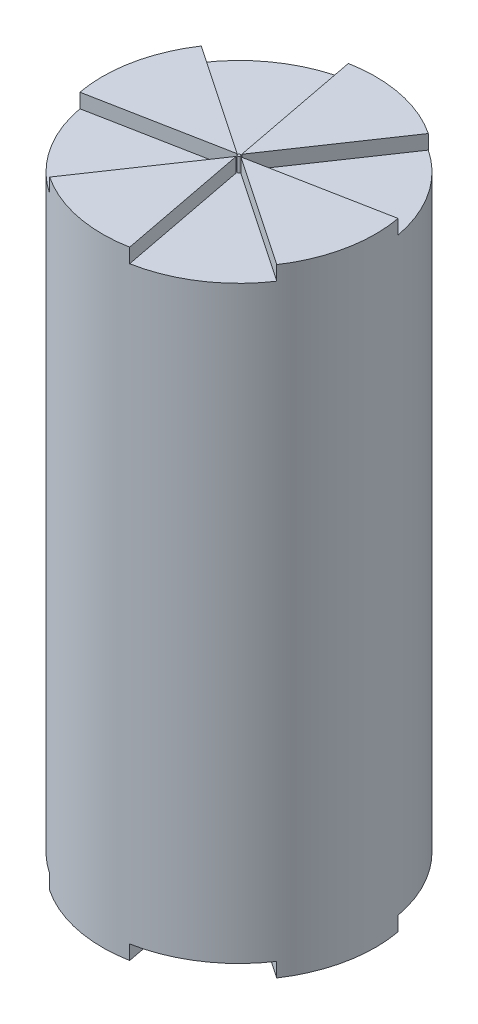
from build123d import *

# Parameters (mm, degrees)
SKETCH1_R            = 24.13
BOSS_EXTRUDE1_DEPTH  = 109.22
CUT_EXTRUDE7_START   = -2.54
CUT_EXTRUDE7_DEPTH   = 2.54
CIRPATTERN2_COUNT    = 4
MIRROR1_START        = -2.54
MIRROR1_COPY_1_DEPTH = 2.54
MIRROR1_COPY_2_DEPTH = 2.54
MIRROR1_COPY_3_DEPTH = 2.54
MIRROR1_COPY_4_DEPTH = 2.54


with BuildPart() as part:
    # Sketch1 → Boss-Extrude1 (new body)
    with BuildSketch(Plane(origin=(0, 0, 0), x_dir=(1, 0, 0), z_dir=(0, 1, 0))):
        Circle(SKETCH1_R)
    extrude(amount=BOSS_EXTRUDE1_DEPTH)

    # Sketch2 → Cut-Extrude7 (cut)
    with BuildSketch(Plane(origin=(0, 109.22, 0), x_dir=(1, 0, 0), z_dir=(0, 1, 0)).offset(CUT_EXTRUDE7_START)):
        with BuildLine():
            Line((-13.398366618, -20.068399836), (0.023672, -0.252894516))
            ThreePointArc((0.023672, -0.252894516), (-0.212080054, -0.139778577), (-0.223069042, 0.12147511))
            Line((-0.223069042, 0.12147511), (-23.725561751, -4.399388549))
            ThreePointArc((-23.725561751, -4.399388549), (-20.147605145, -13.278964829), (-13.398366618, -20.068399836))
        make_face()
    cut_extrude7 = extrude(amount=CUT_EXTRUDE7_DEPTH, mode=Mode.SUBTRACT)

    # CirPattern2: Cut-Extrude7 ×4 about axis
    cirpattern2_axis = Axis((0, 109.22, 0), (0, 1, 0))
    for i in range(1, CIRPATTERN2_COUNT):
        add(cut_extrude7.rotate(cirpattern2_axis, i * 360 / CIRPATTERN2_COUNT), mode=Mode.SUBTRACT)

    # Mirror1 copy 1 sketch → Mirror1 copy 1 (cut)
    with BuildSketch(Plane(origin=(0, 0, 0), x_dir=(0, 0, -1), z_dir=(0, -1, 0)).offset(MIRROR1_START)):
        with BuildLine():
            Line((-13.398366618, 20.068399836), (0.023672, 0.252894516))
            ThreePointArc((0.023672, 0.252894516), (-0.212080054, 0.139778577), (-0.223069042, -0.12147511))
            Line((-0.223069042, -0.12147511), (-23.725561751, 4.399388549))
            ThreePointArc((-23.725561751, 4.399388549), (-20.147605145, 13.278964829), (-13.398366618, 20.068399836))
        make_face()
    extrude(amount=MIRROR1_COPY_1_DEPTH, mode=Mode.SUBTRACT)

    # Mirror1 copy 2 sketch → Mirror1 copy 2 (cut)
    with BuildSketch(Plane(origin=(0, 0, 0), x_dir=(-1, 0, 0), z_dir=(0, -1, 0)).offset(MIRROR1_START)):
        with BuildLine():
            Line((-13.398366618, 20.068399836), (0.023672, 0.252894516))
            ThreePointArc((0.023672, 0.252894516), (-0.212080054, 0.139778577), (-0.223069042, -0.12147511))
            Line((-0.223069042, -0.12147511), (-23.725561751, 4.399388549))
            ThreePointArc((-23.725561751, 4.399388549), (-20.147605145, 13.278964829), (-13.398366618, 20.068399836))
        make_face()
    extrude(amount=MIRROR1_COPY_2_DEPTH, mode=Mode.SUBTRACT)

    # Mirror1 copy 3 sketch → Mirror1 copy 3 (cut)
    with BuildSketch(Plane(origin=(0, 0, 0), x_dir=(0, 0, 1), z_dir=(0, -1, 0)).offset(MIRROR1_START)):
        with BuildLine():
            Line((-13.398366618, 20.068399836), (0.023672, 0.252894516))
            ThreePointArc((0.023672, 0.252894516), (-0.212080054, 0.139778577), (-0.223069042, -0.12147511))
            Line((-0.223069042, -0.12147511), (-23.725561751, 4.399388549))
            ThreePointArc((-23.725561751, 4.399388549), (-20.147605145, 13.278964829), (-13.398366618, 20.068399836))
        make_face()
    extrude(amount=MIRROR1_COPY_3_DEPTH, mode=Mode.SUBTRACT)

    # Mirror1 copy 4 sketch → Mirror1 copy 4 (cut)
    with BuildSketch(Plane.XZ.offset(MIRROR1_START)):
        with BuildLine():
            Line((-13.398366618, 20.068399836), (0.023672, 0.252894516))
            ThreePointArc((0.023672, 0.252894516), (-0.212080054, 0.139778577), (-0.223069042, -0.12147511))
            Line((-0.223069042, -0.12147511), (-23.725561751, 4.399388549))
            ThreePointArc((-23.725561751, 4.399388549), (-20.147605145, 13.278964829), (-13.398366618, 20.068399836))
        make_face()
    extrude(amount=MIRROR1_COPY_4_DEPTH, mode=Mode.SUBTRACT)


solid = part.part
